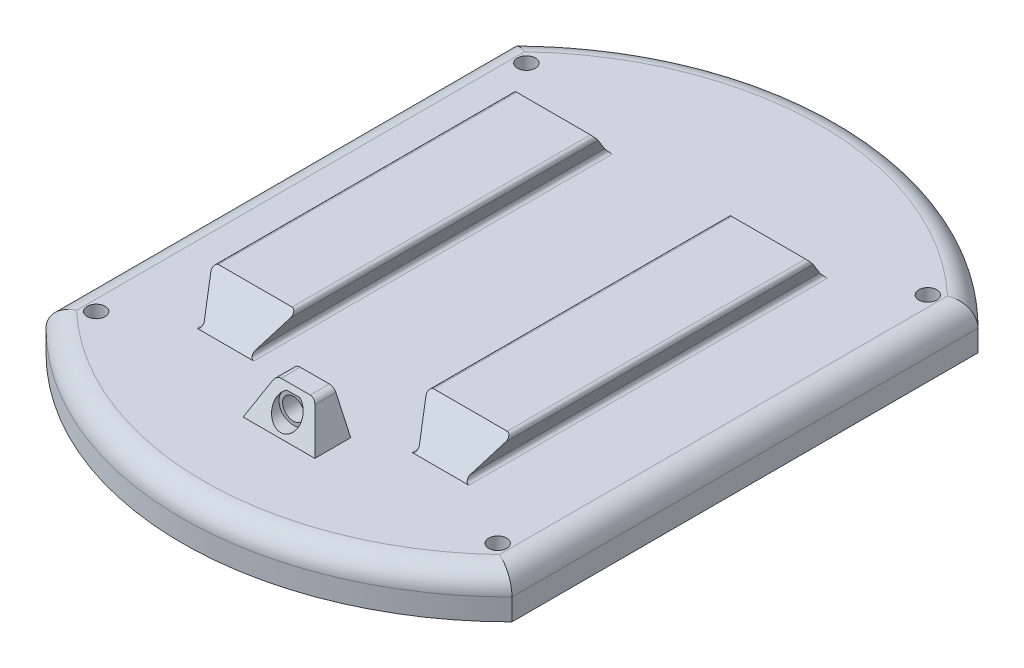
from build123d import *

# Parameters (mm, degrees)
EXTRUDE_1_DEPTH     = 6
CUT_EXTRUDE_1_DEPTH = 3
SKETCH_4_R          = 1.25
CUT_EXTRUDE_3_DEPTH = 57.402570863
EXTRUDE_2_DEPTH     = 25
DRAFT_1_ANGLE       = 40
FILLET_1_R          = 0.5
SKETCH_6_W          = 10
SKETCH_6_H          = 5
EXTRUDE_3_DEPTH     = 5
DRAFT_3_ANGLE       = 25
FILLET_2_R          = 1
SKETCH_7_R          = 1.5
CUT_EXTRUDE_4_DEPTH = 5
SKETCH_8_R          = 2
SKETCH_8_R_2        = 1.5
CUT_EXTRUDE_5_DEPTH = 2
DRAFT_START         = 31.990712649
DRAFT_5_DEPTH       = 3.009287351
FILLET_3_R          = 3


with BuildPart() as part:
    # Эскиз1 → Бобышка-Вытянуть1 (new body)
    with BuildSketch(Plane(origin=(0, 0, 0), x_dir=(1, 0, 0), z_dir=(0, 1, 0))):
        with BuildLine():
            Line((-32.5, -32.5), (-32.5, 32.5))
            ThreePointArc((-32.5, 32.5), (0, 46), (32.5, 32.5))
            Line((32.5, 32.5), (32.5, -32.5))
            ThreePointArc((32.5, -32.5), (0, -46), (-32.5, -32.5))
        make_face()
    extrude(amount=EXTRUDE_1_DEPTH)

    # Эскиз2 → Вырез-Вытянуть1 (cut)
    with BuildSketch(Plane.XZ):
        Polygon((28, -32.598076211), (30.25, -31.299038106), (30.25, -28.700961894), (28, -27.401923789), (25.75, -28.700961894), (25.75, -31.299038106), align=None)
        Polygon((25.75, 31.299038106), (25.75, 28.700961894), (28, 27.401923789), (30.25, 28.700961894), (30.25, 31.299038106), (28, 32.598076211), align=None)
        Polygon((-28, 27.401923789), (-25.75, 28.700961894), (-25.75, 31.299038106), (-28, 32.598076211), (-30.25, 31.299038106), (-30.25, 28.700961894), align=None)
        Polygon((-28, -32.598076211), (-25.75, -31.299038106), (-25.75, -28.700961894), (-28, -27.401923789), (-30.25, -28.700961894), (-30.25, -31.299038106), align=None)
    extrude(amount=-CUT_EXTRUDE_1_DEPTH, mode=Mode.SUBTRACT)

    # Эскиз4 → Вырез-Вытянуть3 (cut, through all)
    with BuildSketch(Plane.XZ.offset(-3)):
        with Locations(Location((28, 30, 0), (0, 0, 270))):
            Circle(SKETCH_4_R)
        with Locations(Location((-28, 30, 0), (0, 0, 270))):
            Circle(SKETCH_4_R)
        with Locations(Location((-28, -30, 0), (0, 0, 270))):
            Circle(SKETCH_4_R)
        with Locations(Location((28, -30, 0), (0, 0, 270))):
            Circle(SKETCH_4_R)
    extrude(amount=-CUT_EXTRUDE_3_DEPTH, mode=Mode.SUBTRACT)

    # Эскиз5 → Бобышка-Вытянуть2 (add, symmetric)
    with BuildSketch(Plane.XY):
        Polygon((-18.113248654, 6), (-11.886751346, 6), (-9, 11), (-21, 11), align=None)
        Polygon((21, 11), (9, 11), (11.886751346, 6), (18.113248654, 6), align=None)
    extrude(amount=EXTRUDE_2_DEPTH, both=True)

    # Уклон1
    draft_1_faces = [part.faces().sort_by_distance(p)[0] for p in [
        (15, 8.763970206, -25),
        (15, 8.763970206, 25),
        (-15, 8.763970206, -25),
        (-15, 8.763970206, 25),
    ]]
    draft(draft_1_faces, Plane.ZX.offset(6), DRAFT_1_ANGLE)

    # Скругление1
    fillet_1_edges = [part.edges().sort_by_distance(p)[0] for p in [
        (-9, 11, 0),
        (-21, 11, 0),
        (-18.113248654, 6, 0),
        (-11.886751346, 6, 0),
        (11.886751346, 6, 0),
        (18.113248654, 6, 0),
        (21, 11, 0),
        (9, 11, 0),
    ]]
    fillet(fillet_1_edges, radius=FILLET_1_R)

    # Эскиз6 → Бобышка-Вытянуть3 (add)
    with BuildSketch(Plane(origin=(0, 6, 0), x_dir=(1, 0, 0), z_dir=(0, 1, 0))):
        with Locations((0, -30)):
            Rectangle(SKETCH_6_W, SKETCH_6_H)
    extrude(amount=EXTRUDE_3_DEPTH)

    # Уклон3
    draft_3_faces = [part.faces().sort_by_distance(p)[0] for p in [
        (5, 8.5, 30),
        (-5, 8.5, 30),
    ]]
    draft(draft_3_faces, Plane.ZX.offset(6), DRAFT_3_ANGLE)

    # Скругление2
    fillet_2_edges = [part.edges().sort_by_distance(p)[0] for p in [
        (2.668461709, 11, 30),
        (-2.668461709, 11, 30),
    ]]
    fillet(fillet_2_edges, radius=FILLET_2_R)

    # Эскиз7 → Вырез-Вытянуть4 (cut)
    with BuildSketch(Plane.XY.offset(32.5)):
        with Locations((0, 8.5)):
            Circle(SKETCH_7_R)
    extrude(amount=-CUT_EXTRUDE_4_DEPTH, mode=Mode.SUBTRACT)

    # Эскиз8 → Вырез-Вытянуть5 (cut)
    with BuildSketch(Plane.XY.offset(32.5)):
        with Locations((0, 8.5)):
            Circle(SKETCH_8_R)
        with Locations((0, 8.5)):
            Circle(SKETCH_8_R_2, mode=Mode.SUBTRACT)
    extrude(amount=-CUT_EXTRUDE_5_DEPTH, mode=Mode.SUBTRACT)

    # Уклон5: read off the stored shape, not the designer's step
    # Уклон5 outline → Уклон5 (cut)
    with BuildSketch(Plane(origin=(0, 0, 0), x_dir=(1, 0, 0), z_dir=(0, 0.4226182617406999, 0.9063077870366498)).offset(DRAFT_START)):
        with BuildLine():
            Line((-5, -8.297246784), (5, -8.297246784))
            Line((5, -8.297246784), (2.937699235, -3.41742745))
            add(Edge.make_bspline(
                [(2.937699235, -3.41742745), (2.668461709, -2.78035719), (2.031391448, -2.78035719)],
                knots=[2.00712864, 2.00712864, 2.00712864, 3.141592654, 3.141592654, 3.141592654], degree=2, weights=[1, 0.843391446, 1]))
            Line((2.031391448, -2.78035719), (-2.031391448, -2.78035719))
            add(Edge.make_bspline(
                [(-2.031391448, -2.78035719), (-2.668461709, -2.78035719), (-2.937699235, -3.41742745)],
                knots=[0, 0, 0, 1.134464014, 1.134464014, 1.134464014], degree=2, weights=[1, 0.843391446, 1]))
            Line((-2.937699235, -3.41742745), (-5, -8.297246784))
        make_face()
    extrude(amount=DRAFT_5_DEPTH, mode=Mode.SUBTRACT)

    # Скругление3
    fillet_3_edges = [part.edges().sort_by_distance(p)[0] for p in [
        (0, 6, 46),
        (32.5, 6, 0),
        (0, 6, -46),
        (-32.5, 6, 0),
    ]]
    fillet(fillet_3_edges, radius=FILLET_3_R)


solid = part.part
